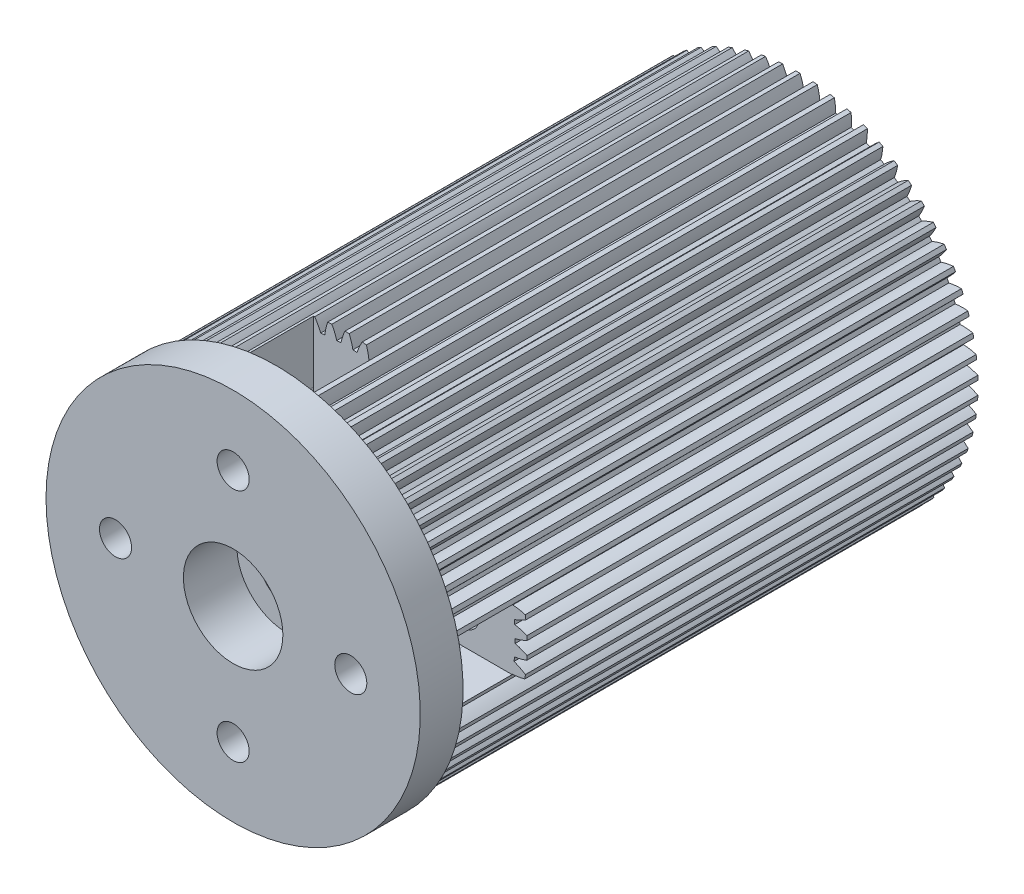
from build123d import *

# Parameters (mm, degrees)
SKETCH1_R               = 17
BOSS_EXTRUDE1_DEPTH     = 24.33026837
CUT_EXTRUDE1_DEPTH      = 35.204706678
CIRPATTERN2_COUNT       = 66
SKETCH3_W               = 17.5
SKETCH3_H               = 4
CHAMFER1_SIZE           = 0.5
CHAMFER2_SIZE           = 0.5
SKETCH4_R               = 2.5
CUT_EXTRUDE2_DEPTH      = 65.128535882
SKETCH5_R               = 4.65
CUT_EXTRUDE3_DEPTH      = 5
CUT_EXTRUDE4_START      = 24.33026837
CUT_EXTRUDE4_OUTLINE_R  = 1.5
CUT_EXTRUDE4_DEPTH      = 4.66973163
CIRPATTERN3_COUNT       = 4
CUT_EXTRUDE9_DEPTH      = 6.5
CIRPATTERN4_COUNT       = 4
CUT_EXTRUDE10_START     = -25
CUT_EXTRUDE10_OUTLINE_R = 1.5
CUT_EXTRUDE10_DEPTH     = 42.83026837


with BuildPart() as part:
    # Sketch1 → Boss-Extrude1 (new, symmetric)
    with BuildSketch(Plane.XY):
        with Locations(Location((0, 0, 0), (0, 0, 180))):
            Circle(SKETCH1_R)
    extrude(amount=BOSS_EXTRUDE1_DEPTH, both=True)

    # Sketch2 → Cut-Extrude1 (cut, symmetric)
    with BuildSketch(Plane.XY):
        with BuildLine():
            ThreePointArc((15.874906082, 0.054606777), (15.87497652, 0.027303429), (15.875, 0))
            ThreePointArc((15.875, 0), (15.874371902, -0.141215161), (15.872487657, -0.282419147))
            ThreePointArc((15.872487657, -0.282419147), (15.871978448, -0.309717837), (15.871422289, -0.337015611))
            add(Edge.make_bspline(
                [(15.871422289, -0.337015611), (15.894901068, -0.342700311), (15.94448644, -0.355203529), (16.019874489, -0.375731347), (16.120525069, -0.405916861), (16.223139983, -0.439457679), (16.324897916, -0.475228084), (16.447567433, -0.521331833), (16.59380796, -0.580464583), (16.746146218, -0.64756163), (16.871608347, -0.707040727), (16.95147011, -0.746686636), (16.982888836, -0.762552812)],
                knots=[0.094970475, 0.094970475, 0.094970475, 0.094970475, 0.094970475, 0.119476176, 0.146842496, 0.174208854, 0.201574956, 0.228941013, 0.256307345, 0.307035032, 0.361767352, 0.397437207, 0.397437207, 0.397437207, 0.397437207, 0.397437207], degree=4))
            ThreePointArc((16.982888836, -0.762552812), (16.995721671, -0.381372384), (17, 0))
            ThreePointArc((17, 0), (16.998441707, 0.230172819), (16.993767115, 0.46030344))
            add(Edge.make_bspline(
                [(15.874906082, 0.054606777), (15.898482277, 0.059872886), (15.948282236, 0.071491992), (16.024023548, 0.090675394), (16.125195205, 0.119065539), (16.228390577, 0.150775511), (16.330768767, 0.184729963), (16.454239065, 0.228644102), (16.601508431, 0.285165848), (16.755016249, 0.349542151), (16.881516666, 0.406779841), (16.962071099, 0.444998721), (16.993767115, 0.46030344)],
                knots=[0.094970475, 0.094970475, 0.094970475, 0.094970475, 0.094970475, 0.119476176, 0.146842496, 0.174208854, 0.201574956, 0.228941013, 0.256307345, 0.307035032, 0.361767352, 0.397437207, 0.397437207, 0.397437207, 0.397437207, 0.397437207], degree=4))
        make_face()
    cut_extrude1 = extrude(amount=CUT_EXTRUDE1_DEPTH, both=True, mode=Mode.SUBTRACT)

    # CirPattern2: Cut-Extrude1 ×66 about axis
    cirpattern2_axis = Axis((0, 0, -24.33026837), (0, 0, 1))
    for i in range(1, CIRPATTERN2_COUNT):
        add(cut_extrude1.rotate(cirpattern2_axis, i * 360 / CIRPATTERN2_COUNT), mode=Mode.SUBTRACT)

    # Sketch3 → Revolve1 (revolve)
    with BuildSketch(Plane(origin=(0, 0, 0), x_dir=(1, 0, 0), z_dir=(0, 1, 0))):
        Polygon((0, 24.33026837), (0, 30.83026837), (-4, 30.83026837), (-4, 25.83026837), (-4.5, 25.83026837), (-4.5, 24.33026837), align=None)
        with Locations((-8.75, -26.33026837)):
            Rectangle(SKETCH3_W, SKETCH3_H)
    revolve(axis=Axis((0, 0, -24.33026837), (0, 0, 1)))

    # Chamfer1
    chamfer1_edges = [part.edges().sort_by_distance(p)[0] for p in [
        (4.5, 0, -24.33026837),
    ]]
    chamfer(chamfer1_edges, length=CHAMFER1_SIZE)

    # Chamfer2
    chamfer2_edges = [part.edges().sort_by_distance(p)[0] for p in [
        (4, 0, -30.83026837),
    ]]
    chamfer(chamfer2_edges, length=CHAMFER2_SIZE)

    # Sketch4 → Cut-Extrude2 (cut, through all)
    with BuildSketch(Plane.XY.offset(28.33026837)):
        Circle(SKETCH4_R)
    extrude(amount=-CUT_EXTRUDE2_DEPTH, mode=Mode.SUBTRACT)

    # Sketch5 → Cut-Extrude3 (cut)
    with BuildSketch(Plane.XY.offset(28.33026837)):
        Circle(SKETCH5_R)
    extrude(amount=-CUT_EXTRUDE3_DEPTH, mode=Mode.SUBTRACT)

    # Cut-Extrude4: read off the stored shape, not the designer's step
    # Cut-Extrude4 outline → Cut-Extrude4 (cut)
    with BuildSketch(Plane.XY.offset(CUT_EXTRUDE4_START)):
        with Locations((11, 0)):
            Circle(CUT_EXTRUDE4_OUTLINE_R)
        with Locations((0, -11)):
            Circle(CUT_EXTRUDE4_OUTLINE_R)
        with Locations((-11, 0)):
            Circle(CUT_EXTRUDE4_OUTLINE_R)
        with Locations((0, 11)):
            Circle(CUT_EXTRUDE4_OUTLINE_R)
    extrude(amount=CUT_EXTRUDE4_DEPTH, mode=Mode.SUBTRACT)

    # Sketch7 → Cut-Revolve1 (revolve, cut)
    with BuildSketch(Plane(origin=(0, 0, 0), x_dir=(1, 0, 0), z_dir=(0, 1, 0)), mode=Mode.PRIVATE) as cut_revolve1_sk:
        Polygon((14, -24.33026837), (11, -24.33026837), (11, -25.83026837), (12.5, -25.83026837), align=None)
    cut_revolve1 = revolve(cut_revolve1_sk.sketch.rotate(Axis((11, 0, 24.33026837), (0, 0, 1)), 180), axis=Axis((11, 0, 24.33026837), (0, 0, 1)), mode=Mode.SUBTRACT)

    # CirPattern3: Cut-Revolve1 ×4 about axis
    cirpattern3_axis = Axis((0, 0, 0), (0, 0, 1))
    for i in range(1, CIRPATTERN3_COUNT):
        add(cut_revolve1.rotate(cirpattern3_axis, i * 360 / CIRPATTERN3_COUNT), mode=Mode.SUBTRACT)

    # Sketch8 → Cut-Extrude9 (cut)
    with BuildSketch(Plane(origin=(0, 0, 24.33026837), x_dir=(-1, 0, 0), z_dir=(0, 0, -1))):
        with BuildLine():
            Line((-3, 17.748239349), (-3, 11))
            ThreePointArc((-3, 11), (0, 8), (3, 11))
            Line((3, 11), (3, 17.748239349))
            ThreePointArc((3, 17.748239349), (0, 18), (-3, 17.748239349))
        make_face()
    cut_extrude9 = extrude(amount=CUT_EXTRUDE9_DEPTH, mode=Mode.SUBTRACT)

    # CirPattern4: Cut-Extrude9 ×4 about axis
    cirpattern4_axis = Axis((0, 0, 0), (0, 0, 1))
    for i in range(1, CIRPATTERN4_COUNT):
        add(cut_extrude9.rotate(cirpattern4_axis, i * 360 / CIRPATTERN4_COUNT), mode=Mode.SUBTRACT)

    # Cut-Extrude10: read off the stored shape, not the designer's step
    # Cut-Extrude10 outline → Cut-Extrude10 (cut)
    with BuildSketch(Plane.XY.offset(CUT_EXTRUDE10_START)):
        with Locations((11, 0)):
            Circle(CUT_EXTRUDE10_OUTLINE_R)
        with Locations((0, -11)):
            Circle(CUT_EXTRUDE10_OUTLINE_R)
        with Locations((-11, 0)):
            Circle(CUT_EXTRUDE10_OUTLINE_R)
        with Locations((0, 11)):
            Circle(CUT_EXTRUDE10_OUTLINE_R)
    extrude(amount=CUT_EXTRUDE10_DEPTH, mode=Mode.SUBTRACT)


solid = part.part
